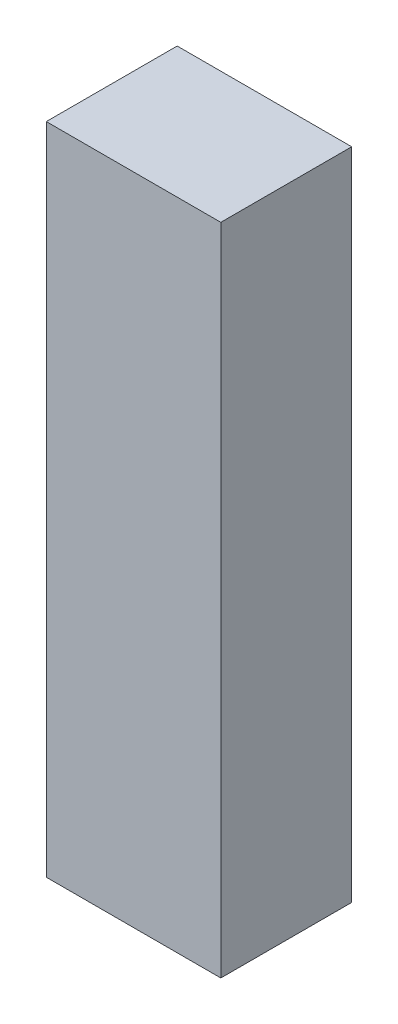
from build123d import *

# Parameters (mm, degrees)
SKETCH_1_W      = 80
SKETCH_1_H      = 60
EXTRUDE_1_DEPTH = 300


with BuildPart() as part:
    # 草图1 → 凸台-拉伸1 (new body)
    with BuildSketch(Plane(origin=(0, 0, 0), x_dir=(1, 0, 0), z_dir=(0, 1, 0))):
        Rectangle(SKETCH_1_W, SKETCH_1_H)
    extrude(amount=EXTRUDE_1_DEPTH)


solid = part.part
